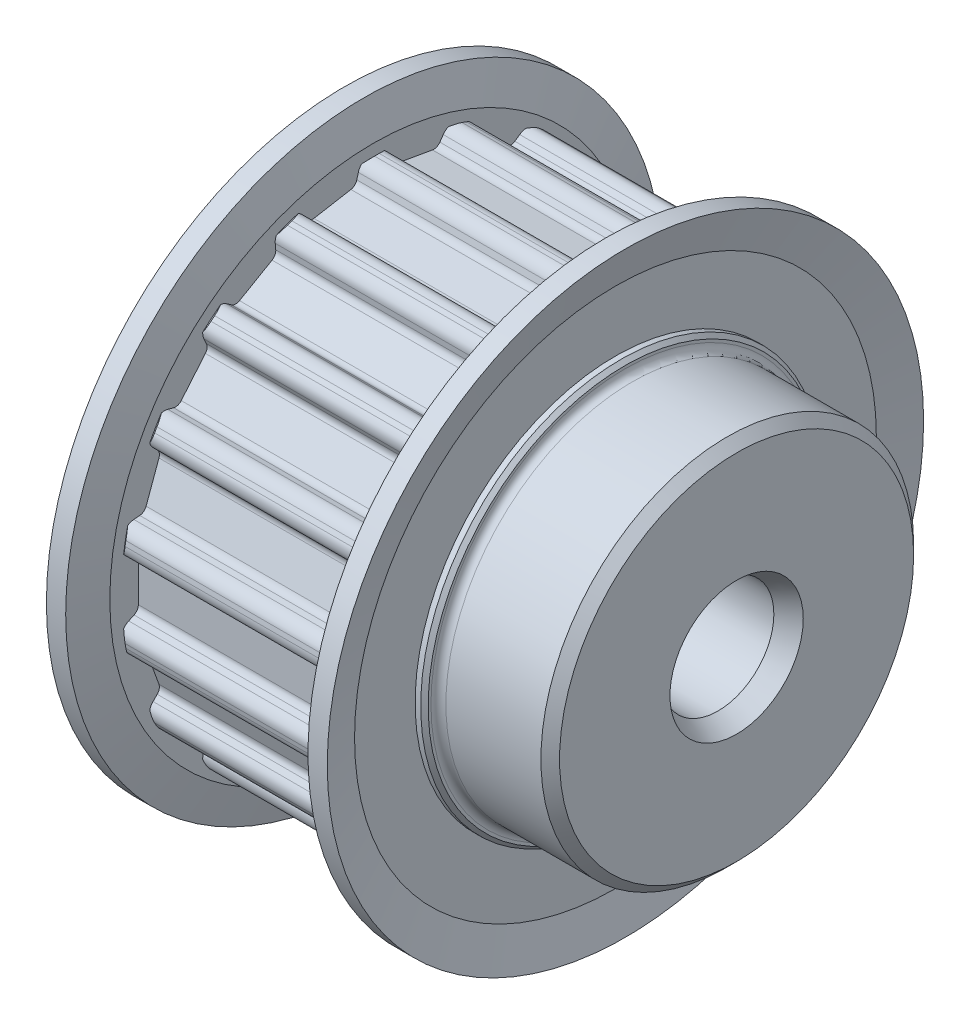
from build123d import *
from OCP.BRepFilletAPI import BRepFilletAPI_MakeChamfer

# Parameters (mm, degrees)
BOSS_EXTRUDE1_START          = 1.5
BOSS_EXTRUDE1_2_DEPTH        = 12
CUT_EXTRUDE1_START           = 0.599992
CUT_EXTRUDE1_DEPTH           = 0.2
BOSS_EXTRUDE2_START          = 0.600001
BOSS_EXTRUDE2_DEPTH          = 0.2
CUT_EXTRUDE2_START           = 0.599992
CUT_EXTRUDE2_DEPTH           = 0.2
BOSS_EXTRUDE3_START          = 0.600001
BOSS_EXTRUDE3_DEPTH          = 0.2
BOSS_EXTRUDE4_START          = 0.600001
BOSS_EXTRUDE4_DEPTH          = 0.2
DRAFT1_ANGLE                 = 66.037511025
DRAFT2_ANGLE                 = 69.44395478
DRAFT3_ANGLE                 = 48.366460663
DRAFT4_ANGLE                 = 38.418055345
DRAFT5_ANGLE                 = 53.130102354
DRAFT6_DEPTH                 = 1
F_6_0_6_DIAMETER_HOLE1_D     = 6
F_6_0_6_DIAMETER_HOLE1_DEPTH = 21.035898385
CHAMFER1_SIZE                = 0.577350568
CHAMFER1_SIZE2               = 1
CHAMFER2_SIZE                = 0.2
CHAMFER3_SIZE                = 0.5
FILLET1_R                    = 0.4
FILLET2_R                    = 0.7


with BuildPart() as part:
    # Boss-Extrude1: read off the stored shape, not the designer's step
    # Boss-Extrude1 outline → Boss-Extrude1 (revolve)
    with BuildSketch(Plane.YX):
        Polygon((13.7, 1.7), (13.7, 13.3), (13.5, 13.5), (14.131652498, 13.5), (16, 14.000622204), (16, 15.035898385), (14, 14.5), (0, 14.5), (0, 0), (10.75, 0), (10.75, 0.5), (14, 0.5), (16, -0.035898385), (16, 0.999377796), (14.131652498, 1.5), (13.5, 1.5), align=None)
        with BuildLine():
            ThreePointArc((11.55, 13.5), (11.15, 13.1), (10.75, 13.5))
            Line((10.75, 13.5), (11.55, 13.5))
        make_face(mode=Mode.SUBTRACT)
        with BuildLine():
            ThreePointArc((10.75, 1.5), (11.15, 1.9), (11.55, 1.5))
            Line((11.55, 1.5), (10.75, 1.5))
        make_face(mode=Mode.SUBTRACT)
    revolve(axis=Axis((0, 0, 0), (1, 0, 0)))

    # Boss-Extrude1 2 outline → Boss-Extrude1 2 (cut)
    with BuildSketch(Plane.YZ.offset(BOSS_EXTRUDE1_START)):
        with BuildLine():
            Line((-12.62787874, 0.944248967), (-12.189276636, 3.43168511))
            Line((-12.189276636, 3.43168511), (-13.08494624, 4.058839969))
            ThreePointArc((-13.08494624, 4.058839969), (-13.491866216, 2.378980034), (-13.684032453, 0.661253221))
            Line((-13.684032453, 0.661253221), (-12.62787874, 0.944248967))
        make_face()
        with BuildLine():
            ThreePointArc((-10.907622397, 8.289377156), (-11.864548032, 6.85), (-12.632622397, 5.301589513))
            Line((-12.632622397, 5.301589513), (-11.543372301, 5.206292683))
            Line((-11.543372301, 5.206292683), (-10.280467874, 7.393707317))
            Line((-10.280467874, 7.393707317), (-10.907622397, 8.289377156))
        make_face()
        with BuildLine():
            Line((-12.62787874, -0.944248967), (-13.684032453, -0.661253221))
            ThreePointArc((-13.684032453, -0.661253221), (-13.491866216, -2.378980034), (-13.08494624, -4.058839969))
            Line((-13.08494624, -4.058839969), (-12.189276636, -3.43168511))
            Line((-12.189276636, -3.43168511), (-12.62787874, -0.944248967))
        make_face()
        with BuildLine():
            ThreePointArc((-7.414678314, 11.52009312), (-8.806190253, 10.494808871), (-10.057531643, 9.302475867))
            Line((-10.057531643, 9.302475867), (-9.066564801, 8.840380665))
            Line((-9.066564801, 8.840380665), (-7.131682963, 10.463939302))
            Line((-7.131682963, 10.463939302), (-7.414678314, 11.52009312))
        make_face()
        with BuildLine():
            Line((-11.543372301, -5.206292683), (-12.632622397, -5.301589513))
            ThreePointArc((-12.632622397, -5.301589513), (-11.864548032, -6.85), (-10.907622397, -8.289377156))
            Line((-10.907622397, -8.289377156), (-10.280467874, -7.393707317))
            Line((-10.280467874, -7.393707317), (-11.543372301, -5.206292683))
        make_face()
        with BuildLine():
            ThreePointArc((-3.027414597, 13.361315836), (-4.685675963, 12.873788905), (-6.269354139, 12.181346341))
            Line((-6.269354139, 12.181346341), (-5.496195777, 11.408188269))
            Line((-5.496195777, 11.408188269), (-3.122711835, 12.272065775))
            Line((-3.122711835, 12.272065775), (-3.027414597, 13.361315836))
        make_face()
        with BuildLine():
            Line((-9.066564801, -8.840380665), (-10.057531643, -9.302475867))
            ThreePointArc((-10.057531643, -9.302475867), (-8.806190253, -10.494808871), (-7.414678314, -11.52009312))
            Line((-7.414678314, -11.52009312), (-7.131682963, -10.463939302))
            Line((-7.131682963, -10.463939302), (-9.066564801, -8.840380665))
        make_face()
        with BuildLine():
            ThreePointArc((1.725, 13.590966669), (0, 13.7), (-1.725, 13.590966669))
            Line((-1.725, 13.590966669), (-1.262904428, 12.6))
            Line((-1.262904428, 12.6), (1.262904428, 12.6))
            Line((1.262904428, 12.6), (1.725, 13.590966669))
        make_face()
        with BuildLine():
            Line((-5.496195777, -11.408188269), (-6.269354139, -12.181346341))
            ThreePointArc((-6.269354139, -12.181346341), (-4.685675963, -12.873788905), (-3.027414597, -13.361315836))
            Line((-3.027414597, -13.361315836), (-3.122711835, -12.272065775))
            Line((-3.122711835, -12.272065775), (-5.496195777, -11.408188269))
        make_face()
        with BuildLine():
            ThreePointArc((6.269354139, 12.181346341), (4.685675963, 12.873788905), (3.027414597, 13.361315836))
            Line((3.027414597, 13.361315836), (3.122711835, 12.272065775))
            Line((3.122711835, 12.272065775), (5.496195777, 11.408188269))
            Line((5.496195777, 11.408188269), (6.269354139, 12.181346341))
        make_face()
        with BuildLine():
            Line((-1.262904428, -12.6), (-1.725, -13.590966669))
            ThreePointArc((-1.725, -13.590966669), (0, -13.7), (1.725, -13.590966669))
            Line((1.725, -13.590966669), (1.262904428, -12.6))
            Line((1.262904428, -12.6), (-1.262904428, -12.6))
        make_face()
        with BuildLine():
            ThreePointArc((10.057531643, 9.302475867), (8.806190253, 10.494808871), (7.414678314, 11.52009312))
            Line((7.414678314, 11.52009312), (7.131682963, 10.463939302))
            Line((7.131682963, 10.463939302), (9.066564801, 8.840380665))
            Line((9.066564801, 8.840380665), (10.057531643, 9.302475867))
        make_face()
        with BuildLine():
            Line((3.122711835, -12.272065775), (3.027414597, -13.361315836))
            ThreePointArc((3.027414597, -13.361315836), (4.685675963, -12.873788905), (6.269354139, -12.181346341))
            Line((6.269354139, -12.181346341), (5.496195777, -11.408188269))
            Line((5.496195777, -11.408188269), (3.122711835, -12.272065775))
        make_face()
        with BuildLine():
            ThreePointArc((12.632622397, 5.301589513), (11.864548032, 6.85), (10.907622397, 8.289377156))
            Line((10.907622397, 8.289377156), (10.280467874, 7.393707317))
            Line((10.280467874, 7.393707317), (11.543372301, 5.206292683))
            Line((11.543372301, 5.206292683), (12.632622397, 5.301589513))
        make_face()
        with BuildLine():
            Line((7.131682963, -10.463939302), (7.414678314, -11.52009312))
            ThreePointArc((7.414678314, -11.52009312), (8.806190253, -10.494808871), (10.057531643, -9.302475867))
            Line((10.057531643, -9.302475867), (9.066564801, -8.840380665))
            Line((9.066564801, -8.840380665), (7.131682963, -10.463939302))
        make_face()
        with BuildLine():
            ThreePointArc((13.684032453, 0.661253221), (13.491866216, 2.378980034), (13.08494624, 4.058839969))
            Line((13.08494624, 4.058839969), (12.189276636, 3.43168511))
            Line((12.189276636, 3.43168511), (12.62787874, 0.944248967))
            Line((12.62787874, 0.944248967), (13.684032453, 0.661253221))
        make_face()
        with BuildLine():
            Line((10.280467874, -7.393707317), (10.907622397, -8.289377156))
            ThreePointArc((10.907622397, -8.289377156), (11.864548032, -6.85), (12.632622397, -5.301589513))
            Line((12.632622397, -5.301589513), (11.543372301, -5.206292683))
            Line((11.543372301, -5.206292683), (10.280467874, -7.393707317))
        make_face()
        with BuildLine():
            ThreePointArc((13.08494624, -4.058839969), (13.491866216, -2.378980034), (13.684032453, -0.661253221))
            Line((13.684032453, -0.661253221), (12.62787874, -0.944248967))
            Line((12.62787874, -0.944248967), (12.189276636, -3.43168511))
            Line((12.189276636, -3.43168511), (13.08494624, -4.058839969))
        make_face()
    extrude(amount=BOSS_EXTRUDE1_2_DEPTH, mode=Mode.SUBTRACT)

    # Sketch2 → Cut-Extrude1 (cut)
    with BuildSketch(Plane.ZY.offset(-0.599992262).offset(CUT_EXTRUDE1_START)):
        with BuildLine():
            Line((7.102453842, -1.979749851), (7.069100655, -1.97498511))
            Line((7.069100655, -1.97498511), (7.102453842, -1.798689696))
            ThreePointArc((7.102453842, -1.798689696), (7.033984302, -1.788179879), (6.966004345, -1.774865992))
            Line((6.966004345, -1.774865992), (6.659332936, -1.774865992))
            Line((6.659332936, -1.774865992), (6.659332936, -1.779630733))
            Line((6.659332936, -1.779630733), (6.462603977, -1.779630733))
            ThreePointArc((6.462603977, -1.779630733), (6.303573262, -1.687065269), (6.154270399, -1.579511614))
            Line((6.154270399, -1.579511614), (6.050041691, -1.496128648))
            Line((6.050041691, -1.496128648), (6.187623585, -1.496128648))
            Line((6.187623585, -1.496128648), (6.187623585, -1.491363907))
            Line((6.187623585, -1.491363907), (6.240035736, -1.419892793))
            ThreePointArc((6.240035736, -1.419892793), (6.083460263, -1.281054329), (5.944621799, -1.124478856))
            ThreePointArc((5.944621799, -1.124478856), (5.912187857, -1.146724934), (5.880297796, -1.169743895))
            Line((5.880297796, -1.169743895), (5.801679571, -1.229303157))
            add(Edge.make_bspline(
                [(5.801679571, -1.229303157), (5.780336919, -1.199256766), (5.737661723, -1.139178215), (5.674296702, -1.048506023), (5.616814382, -0.954007195), (5.564283796, -0.856422409), (5.538308043, -0.787352324), (5.525324598, -0.752829065)],
                knots=[0, 0, 0, 0, 0.200002243, 0.399909752, 0.600005409, 0.800070941, 1, 1, 1, 1], degree=3))
            Line((5.525324598, -0.752829065), (5.515795116, -0.724240619))
            Line((5.515795116, -0.724240619), (5.680178678, -0.659916617))
            ThreePointArc((5.680178678, -0.659916617), (5.619495852, -0.478169538), (5.580119119, -0.290649196))
            Line((5.580119119, -0.290649196), (5.406206075, -0.314472901))
            ThreePointArc((5.406206075, -0.314472901), (5.380013041, -0.025367619), (5.396676593, 0.264443121))
            Line((5.396676593, 0.264443121), (5.401441334, 0.295413937))
            Line((5.401441334, 0.295413937), (5.580119119, 0.273972603))
            ThreePointArc((5.580119119, 0.273972603), (5.6164888, 0.462689224), (5.675413937, 0.645622394))
            Line((5.675413937, 0.645622394), (5.511030375, 0.714711138))
            ThreePointArc((5.511030375, 0.714711138), (5.62647015, 0.963406922), (5.775473496, 1.1935676))
            Line((5.775473496, 1.1935676), (5.79691483, 1.222156045))
            ThreePointArc((5.79691483, 1.222156045), (5.833304051, 1.192873301), (5.870768314, 1.164979154))
            Line((5.870768314, 1.164979154), (5.939857058, 1.117331745))
            ThreePointArc((5.939857058, 1.117331745), (6.052027367, 1.248173052), (6.175711733, 1.368188899))
            Line((6.175711733, 1.368188899), (6.175711733, 1.484216796))
            Line((6.175711733, 1.484216796), (6.170946992, 1.484216796))
            Line((6.170946992, 1.484216796), (6.170946992, 1.488981537))
            Line((6.170946992, 1.488981537), (6.009739925, 1.488981537))
            Line((6.009739925, 1.488981537), (6.144740917, 1.569982132))
            ThreePointArc((6.144740917, 1.569982132), (6.361696399, 1.720340447), (6.597391304, 1.839189994))
            Line((6.597391304, 1.839189994), (6.62597975, 1.851101846))
            Line((6.62597975, 1.851101846), (6.654568195, 1.774865992))
            Line((6.654568195, 1.774865992), (6.697450864, 1.689100655))
            ThreePointArc((6.697450864, 1.689100655), (6.892507023, 1.7579514), (7.09530673, 1.798689696))
            ThreePointArc((7.09530673, 1.798689696), (7.091590782, 1.841688897), (7.085777248, 1.884455033))
            Line((7.085777248, 1.884455033), (7.069100655, 1.97498511))
            ThreePointArc((7.069100655, 1.97498511), (7.224602663, 1.994013629), (7.381191185, 1.998808815))
            add(Edge.make_bspline(
                [(7.381191185, 1.998808815), (7.45203674, 1.996994621), (7.593198497, 1.993379789), (7.803193753, 1.962181387), (8.008880995, 1.909925003), (8.207528977, 1.834674717), (8.395746858, 1.737295748), (8.571868231, 1.619595106), (8.734797845, 1.483520074), (8.884192866, 1.332295422), (9.018302331, 1.167257658), (9.133886475, 0.988708549), (9.228369717, 0.798341396), (9.300357373, 0.598770411), (9.349108675, 0.39234191), (9.376352752, 0.181454409), (9.383074903, -0.031437727), (9.370550275, -0.24421045), (9.337166254, -0.454088906), (9.28149928, -0.658415725), (9.203139502, -0.85499281), (9.102296581, -1.041880183), (8.980922003, -1.216827762), (8.841873002, -1.37824624), (8.688224759, -1.525375246), (8.521145912, -1.656390142), (8.341045669, -1.768494296), (8.149013054, -1.859427694), (7.947717296, -1.928135503), (7.739965459, -1.973935165), (7.528595626, -1.997119286), (7.315027869, -2.002644728), (7.173342355, -1.987384762), (7.102453842, -1.979749851)],
                knots=[0, 0, 0, 0, 0.032308071, 0.064374738, 0.096613275, 0.128966068, 0.161062086, 0.193088519, 0.225413543, 0.257744152, 0.28992787, 0.322264636, 0.35457742, 0.386674981, 0.418841227, 0.451152528, 0.483525581, 0.515877705, 0.548253272, 0.580304222, 0.612295338, 0.644586562, 0.676975285, 0.709246578, 0.74162594, 0.773880904, 0.805940243, 0.838206323, 0.870603399, 0.902776772, 0.935049547, 0.967503798, 1, 1, 1, 1], degree=3))
        make_face()
    extrude(amount=-CUT_EXTRUDE1_DEPTH, mode=Mode.SUBTRACT)

    # Sketch3 → Boss-Extrude2 (add)
    with BuildSketch(Plane(origin=(-0.400000872, 0, 0), x_dir=(0, 0, -1), z_dir=(1, 0, 0)).offset(BOSS_EXTRUDE2_START)):
        with BuildLine():
            Line((-7.140571769, 1.927337701), (-7.159630733, 1.751042287))
            ThreePointArc((-7.159630733, 1.751042287), (-6.922326928, 1.70207879), (-6.692686123, 1.624776653))
            add(Edge.make_bspline(
                [(-6.692686123, 1.624776653), (-6.691296746, 1.624181206), (-6.688517605, 1.622990145), (-6.684348699, 1.621203471), (-6.680179405, 1.619416631), (-6.676010111, 1.617629791), (-6.671840818, 1.615842951), (-6.667671524, 1.61405611), (-6.66350223, 1.61226927), (-6.660722701, 1.611078043), (-6.659332936, 1.61048243)],
                knots=[0, 0, 0, 0, 0.12496947, 0.249973831, 0.374978193, 0.499982554, 0.624986916, 0.749991277, 0.874995639, 1, 1, 1, 1], degree=3))
            Line((-6.659332936, 1.61048243), (-6.592626563, 1.770101251))
            ThreePointArc((-6.592626563, 1.770101251), (-6.392344486, 1.668083212), (-6.206682549, 1.541393687))
            Line((-6.206682549, 1.541393687), (-6.311506849, 1.4032162))
            ThreePointArc((-6.311506849, 1.4032162), (-6.13435142, 1.233706361), (-5.966063133, 1.055390113))
            add(Edge.make_bspline(
                [(-5.966063133, 1.055390113), (-5.965368772, 1.054596558), (-5.963979482, 1.053008798), (-5.961895263, 1.050626833), (-5.959810476, 1.048244219), (-5.957725688, 1.045861605), (-5.955640901, 1.043478991), (-5.953556114, 1.041096377), (-5.951471327, 1.038713763), (-5.950081469, 1.037125354), (-5.94938654, 1.036331149)],
                knots=[0, 0, 0, 0, 0.124910577, 0.249923352, 0.374936127, 0.499948901, 0.624961676, 0.749974451, 0.874987225, 1, 1, 1, 1], degree=3))
            Line((-5.94938654, 1.036331149), (-5.811209053, 1.136390709))
            ThreePointArc((-5.811209053, 1.136390709), (-5.689058059, 0.947484388), (-5.5896486, 0.745681954))
            Line((-5.5896486, 0.745681954), (-5.751649792, 0.67421084))
            add(Edge.make_bspline(
                [(-5.751649792, 0.67421084), (-5.742200064, 0.654565829), (-5.72334319, 0.615364326), (-5.70217177, 0.553575044), (-5.684745688, 0.490809001), (-5.669167233, 0.427503392), (-5.655013826, 0.363862237), (-5.642014847, 0.299969705), (-5.634104327, 0.257226959), (-5.630148898, 0.235854675)],
                knots=[0, 0, 0, 0, 0.143193844, 0.285742462, 0.428554327, 0.571406405, 0.714249876, 0.85711885, 1, 1, 1, 1], degree=3))
            add(Edge.make_bspline(
                [(-5.630148898, 0.235854675), (-5.629950276, 0.234762251), (-5.629553135, 0.232577979), (-5.628957477, 0.229301859), (-5.628361924, 0.226026316), (-5.62776637, 0.222750773), (-5.627170817, 0.21947523), (-5.626575264, 0.216199687), (-5.625979711, 0.212924144), (-5.625582675, 0.210740448), (-5.625384157, 0.2096486)],
                knots=[0, 0, 0, 0, 0.12505775, 0.2500495, 0.37504125, 0.500033, 0.62502475, 0.7500165, 0.87500825, 1, 1, 1, 1], degree=3))
            Line((-5.625384157, 0.2096486), (-5.456235855, 0.228707564))
            ThreePointArc((-5.456235855, 0.228707564), (-5.441909228, -0.008338297), (-5.456235855, -0.245384157))
            Line((-5.456235855, -0.245384157), (-5.630148898, -0.219178082))
            ThreePointArc((-5.630148898, -0.219178082), (-5.678073774, -0.445842803), (-5.746885051, -0.667063728))
            add(Edge.make_bspline(
                [(-5.746885051, -0.667063728), (-5.747282226, -0.668255256), (-5.748076448, -0.670637919), (-5.749267714, -0.674211719), (-5.750458851, -0.677785128), (-5.751649987, -0.681358537), (-5.752841123, -0.684931947), (-5.75403226, -0.688505356), (-5.755223396, -0.692078765), (-5.756017487, -0.694461038), (-5.756414532, -0.695652174)],
                knots=[0, 0, 0, 0, 0.125035884, 0.250030758, 0.375025632, 0.500020505, 0.625015379, 0.750010253, 0.875005126, 1, 1, 1, 1], degree=3))
            Line((-5.756414532, -0.695652174), (-5.596795712, -0.757593806))
            ThreePointArc((-5.596795712, -0.757593806), (-5.695249061, -0.956889786), (-5.815973794, -1.14353782))
            Line((-5.815973794, -1.14353782), (-5.961298392, -1.043478261))
            Line((-5.961298392, -1.043478261), (-5.975592615, -1.069684336))
            ThreePointArc((-5.975592615, -1.069684336), (-6.12696199, -1.242179523), (-6.297212627, -1.396069089))
            Line((-6.297212627, -1.396069089), (-6.321036331, -1.410363311))
            Line((-6.321036331, -1.410363311), (-6.216212031, -1.548540798))
            ThreePointArc((-6.216212031, -1.548540798), (-6.402301341, -1.673440205), (-6.602156045, -1.774865992))
            Line((-6.602156045, -1.774865992), (-6.664097677, -1.615247171))
            ThreePointArc((-6.664097677, -1.615247171), (-6.899003385, -1.694833633), (-7.140571769, -1.751042287))
            Line((-7.140571769, -1.751042287), (-7.171542585, -1.751042287))
            Line((-7.171542585, -1.751042287), (-7.171542585, -1.93045584))
            add(Edge.make_bspline(
                [(-7.171542585, -1.93045584), (-7.250042229, -1.935683482), (-7.406726233, -1.94611777), (-7.641648205, -1.930113263), (-7.872566568, -1.888909159), (-8.096484307, -1.818024335), (-8.309298685, -1.71902478), (-8.507413052, -1.59330235), (-8.688824367, -1.44463635), (-8.853665614, -1.276757873), (-8.998888751, -1.091072148), (-9.120288605, -0.889847569), (-9.213830073, -0.675396732), (-9.279128766, -0.450718371), (-9.316080671, -0.219135987), (-9.326929114, 0.015798937), (-9.312887368, 0.250323001), (-9.272515888, 0.481263377), (-9.203935925, 0.7052702), (-9.106319677, 0.91849823), (-8.982262587, 1.117746035), (-8.834590522, 1.300375038), (-8.668152273, 1.465643919), (-8.484826284, 1.611418149), (-8.285010899, 1.733354137), (-8.070994602, 1.828675996), (-7.846311148, 1.895031809), (-7.615092445, 1.934792813), (-7.459325126, 1.939347341), (-7.381191185, 1.941631924)],
                knots=[0, 0, 0, 0, 0.037306041, 0.074462245, 0.111427352, 0.148403624, 0.185607573, 0.222518384, 0.259467575, 0.296693194, 0.333968825, 0.371099911, 0.407931997, 0.4446954, 0.481852835, 0.518972765, 0.556109067, 0.593145534, 0.629984766, 0.666988335, 0.704132457, 0.741088396, 0.778211151, 0.815249187, 0.851998464, 0.88901831, 0.926111128, 0.962936842, 1, 1, 1, 1], degree=3))
            ThreePointArc((-7.381191185, 1.941631924), (-7.260694574, 1.937631016), (-7.140571769, 1.927337701))
        make_face()
    extrude(amount=-BOSS_EXTRUDE2_DEPTH)

    # Sketch4 → Cut-Extrude2 (cut)
    with BuildSketch(Plane.ZY.offset(-0.599992262).offset(CUT_EXTRUDE2_START)):
        with BuildLine():
            Line((7.381191185, -1.824895771), (7.350220369, -1.824895771))
            Line((7.350220369, -1.824895771), (7.350220369, -1.272185825))
            add(Edge.make_bspline(
                [(7.350220369, -1.272185825), (7.310700091, -1.258274722), (7.231836083, -1.230514662), (7.121730852, -1.169212079), (7.020828879, -1.093912397), (6.931049401, -1.00518577), (6.853246018, -0.906047755), (6.790759144, -0.796479623), (6.747000456, -0.678349906), (6.723273481, -0.554440566), (6.719425729, -0.428716314), (6.728852086, -0.303492176), (6.75287842, -0.180059215), (6.794480517, -0.060949375), (6.855171124, 0.049947998), (6.931514287, 0.151502541), (6.994603224, 0.207695557), (7.026217987, 0.235854675)],
                knots=[0, 0, 0, 0, 0.066581319, 0.132865203, 0.199617166, 0.266412632, 0.333153695, 0.399599409, 0.466319627, 0.532724342, 0.599444346, 0.66592196, 0.732240512, 0.79902568, 0.865821558, 0.932761276, 1, 1, 1, 1], degree=3))
            add(Edge.make_bspline(
                [(7.026217987, 0.235854675), (7.038619729, 0.200967957), (7.063347977, 0.131406163), (7.114407181, 0.033142177), (7.178365708, -0.0567711), (7.256359852, -0.136028013), (7.318869324, -0.17553834), (7.350220369, -0.195354378)],
                knots=[0, 0, 0, 0, 0.201015049, 0.400810624, 0.599310374, 0.799037837, 1, 1, 1, 1], degree=3))
            Line((7.350220369, -0.195354378), (7.350220369, 0.285884455))
            Line((7.350220369, 0.285884455), (6.030387135, 0.285884455))
            add(Edge.make_bspline(
                [(6.030387135, 0.285884455), (6.04746587, 0.352827835), (6.081566188, 0.48649058), (6.167713972, 0.675728251), (6.279703538, 0.850128566), (6.417431516, 1.005539467), (6.574534864, 1.140348423), (6.749842049, 1.251280021), (6.940693782, 1.332005929), (7.142807745, 1.382324481), (7.28098397, 1.38989389), (7.350220369, 1.393686718)],
                knots=[0, 0, 0, 0, 0.111208475, 0.222044808, 0.333472008, 0.444245955, 0.555598104, 0.666232026, 0.777291836, 0.888406914, 1, 1, 1, 1], degree=3))
            Line((7.350220369, 1.393686718), (7.350220369, 1.824895771))
            add(Edge.make_bspline(
                [(7.381190873, 1.824895771), (7.379900435, 1.824895771), (7.37731956, 1.824895771), (7.373448247, 1.824895771), (7.369576934, 1.824895771), (7.365705621, 1.824895771), (7.361834308, 1.824895771), (7.357962995, 1.824895771), (7.354091682, 1.824895771), (7.351510807, 1.824895771), (7.350220369, 1.824895771)],
                knots=[0, 0, 0, 0, 0.125, 0.25, 0.375, 0.5, 0.625, 0.75, 0.875, 1, 1, 1, 1], degree=3))
            add(Edge.make_bspline(
                [(7.381190873, 1.824895771), (7.45240589, 1.822887825), (7.594365027, 1.818885208), (7.804830898, 1.784377351), (8.009828187, 1.726836857), (8.205686613, 1.643661231), (8.389606169, 1.536631961), (8.559235126, 1.407962248), (8.71391988, 1.261226235), (8.852638044, 1.09892977), (8.971251491, 0.921321305), (9.067128347, 0.730579495), (9.137491595, 0.529157516), (9.182740742, 0.32083677), (9.204682178, 0.108492302), (9.204582921, -0.105245646), (9.183240311, -0.317620673), (9.137909607, -0.52554017), (9.067728949, -0.726227076), (8.972493077, -0.916774263), (8.854169689, -1.094522915), (8.715593862, -1.257087995), (8.560950529, -1.404136316), (8.391407467, -1.533418474), (8.207468842, -1.641241144), (8.011443412, -1.725317676), (7.806002273, -1.783587889), (7.594957347, -1.818720633), (7.452570555, -1.82283381), (7.381191185, -1.824895771)],
                knots=[0, 0, 0, 0, 0.037162807, 0.074079881, 0.111016391, 0.148094492, 0.184859296, 0.221837507, 0.2590005, 0.295976674, 0.333079957, 0.370234485, 0.407135284, 0.444172871, 0.481285841, 0.518379094, 0.555584527, 0.592516302, 0.629221744, 0.666298282, 0.703439043, 0.740428093, 0.777598603, 0.814655615, 0.851496301, 0.888639445, 0.925697557, 0.962751731, 1, 1, 1, 1], degree=3))
        make_face()
    extrude(amount=-CUT_EXTRUDE2_DEPTH, mode=Mode.SUBTRACT)

    # Sketch5 → Boss-Extrude3 (add)
    with BuildSketch(Plane(origin=(-0.400000872, 0, 0), x_dir=(0, 0, -1), z_dir=(1, 0, 0)).offset(BOSS_EXTRUDE3_START)):
        with BuildLine():
            Line((-7.40739726, 1.76533651), (-7.40739726, 1.393686718))
            add(Edge.make_bspline(
                [(-7.40739726, 1.393686718), (-7.476521095, 1.39014754), (-7.614298432, 1.383093264), (-7.816127547, 1.335479127), (-8.007823202, 1.257768233), (-8.184133894, 1.149130436), (-8.341943404, 1.01435891), (-8.480152217, 0.859623535), (-8.595463876, 0.687279152), (-8.683287145, 0.499948376), (-8.739677229, 0.301222982), (-8.767752817, 0.096836126), (-8.769703692, -0.109495119), (-8.747653968, -0.314563531), (-8.697282196, -0.515229963), (-8.61483415, -0.705034314), (-8.501439254, -0.878479397), (-8.360262497, -1.030310623), (-8.199783547, -1.161656766), (-8.018670568, -1.26404428), (-7.819290124, -1.322864011), (-7.610614972, -1.333273692), (-7.475299292, -1.305288092), (-7.40739726, -1.291244789)],
                knots=[0, 0, 0, 0, 0.047854729, 0.095383845, 0.142801274, 0.190549288, 0.238125312, 0.286039388, 0.333791933, 0.381228708, 0.428704989, 0.476284599, 0.523682958, 0.571262089, 0.618753225, 0.66639454, 0.713896459, 0.761534428, 0.80942109, 0.857040866, 0.904595619, 0.952125641, 1, 1, 1, 1], degree=3))
            Line((-7.40739726, -1.291244789), (-7.40739726, -1.76533651))
            add(Edge.make_bspline(
                [(-7.40739726, -1.76533651), (-7.481124983, -1.761632553), (-7.628118881, -1.754247827), (-7.845038956, -1.711429176), (-8.055062378, -1.643263757), (-8.253909298, -1.546962942), (-8.43840306, -1.425607167), (-8.606116449, -1.281903546), (-8.756660195, -1.120387703), (-8.887200906, -0.942386711), (-8.993911553, -0.7492441), (-9.073341414, -0.543235846), (-9.124637674, -0.328580608), (-9.148258138, -0.109032281), (-9.146946139, 0.112000849), (-9.121570042, 0.331749974), (-9.070182198, 0.546342124), (-8.990821323, 0.752348903), (-8.884528471, 0.945774607), (-8.753810228, 1.123816893), (-8.603067588, 1.284775601), (-8.435605241, 1.427751056), (-8.251568799, 1.548601268), (-8.053343376, 1.644152071), (-7.843942937, 1.711969589), (-7.627470325, 1.754399396), (-7.48091681, 1.761682761), (-7.40739726, 1.76533651)],
                knots=[0, 0, 0, 0, 0.040200279, 0.080148898, 0.120114596, 0.160278551, 0.20020609, 0.240166862, 0.280394098, 0.320319041, 0.360199643, 0.400328085, 0.44030684, 0.480166459, 0.520414411, 0.56056665, 0.600501089, 0.640379461, 0.680549981, 0.720455919, 0.760471637, 0.80051487, 0.840214785, 0.880164444, 0.920091884, 0.959913559, 1, 1, 1, 1], degree=3))
        make_face()
    extrude(amount=-BOSS_EXTRUDE3_DEPTH)

    # Sketch6 → Boss-Extrude4 (add)
    with BuildSketch(Plane(origin=(-0.400000872, 0, 0), x_dir=(0, 0, -1), z_dir=(1, 0, 0)).offset(BOSS_EXTRUDE4_START)):
        with BuildLine():
            Line((-7.40739726, 0.285884455), (-7.40739726, -0.226325194))
            add(Edge.make_bspline(
                [(-7.40739726, -0.226325194), (-7.433944176, -0.236911021), (-7.486925703, -0.258037894), (-7.571872101, -0.27070744), (-7.657222602, -0.268349102), (-7.740560582, -0.248662931), (-7.817410386, -0.210561807), (-7.883223126, -0.155128011), (-7.928521004, -0.081282808), (-7.947512938, 0.002901233), (-7.941846799, 0.088873208), (-7.908775664, 0.16906305), (-7.850892406, 0.232414646), (-7.776335731, 0.277933944), (-7.719415181, 0.283230838), (-7.690899345, 0.285884455)],
                knots=[0, 0, 0, 0, 0.077402522, 0.154477602, 0.231267458, 0.308170181, 0.38508564, 0.462292546, 0.538805094, 0.615946026, 0.693059762, 0.769437315, 0.846554039, 0.923127237, 1, 1, 1, 1], degree=3))
            add(Edge.make_bspline(
                [(-7.690899345, 0.285884455), (-7.659399019, 0.285884455), (-7.596398509, 0.285884455), (-7.501897814, 0.285884455), (-7.438897445, 0.285884455), (-7.40739726, 0.285884455)],
                knots=[0, 0, 0, 0, 0.333334328, 0.666667164, 1, 1, 1, 1], degree=3))
        make_face()
    extrude(amount=-BOSS_EXTRUDE4_DEPTH)

    # Draft1
    draft1_faces = [part.faces().sort_by_distance(p)[0] for p in [
        (0.100000262, -1.774865992, 6.81266864),
    ]]
    draft(draft1_faces, Plane(origin=(0.2, 0, 6.659332936), x_dir=(0, -1, 0), z_dir=(0, 0, -1)), DRAFT1_ANGLE)

    # Draft2
    draft2_faces = [part.faces().sort_by_distance(p)[0] for p in [
        (0.100000262, -1.779630733, 6.560968457),
    ]]
    draft(draft2_faces, Plane(origin=(0.2, 0, 6.659332936), x_dir=(0, -1, 0), z_dir=(0, 0, -1)), DRAFT2_ANGLE)

    # Draft3
    draft3_faces = [part.faces().sort_by_distance(p)[0] for p in [
        (0.100000262, -1.496128648, 6.118832638),
    ]]
    draft(draft3_faces, Plane(origin=(0.2, 0, 6.187623585), x_dir=(1, 0, 0), z_dir=(0, 0, 1)), DRAFT3_ANGLE)

    # Draft4
    draft4_faces = [part.faces().sort_by_distance(p)[0] for p in [
        (0.100000262, 1.426202848, 6.175711733),
    ]]
    draft(draft4_faces, Plane(origin=(0.2, 1.484216796, 0), x_dir=(1, 0, 0), z_dir=(0, 1, 0)), DRAFT4_ANGLE)

    # Draft5
    draft5_faces = [part.faces().sort_by_distance(p)[0] for p in [
        (0.100000262, 1.488981537, 6.090343458),
    ]]
    draft(draft5_faces, Plane(origin=(0.2, 0, 6.170946992), x_dir=(1, 0, 0), z_dir=(0, 0, 1)), DRAFT5_ANGLE)

    # Draft6: read off the stored shape, not the designer's step
    # Draft6 outline → Draft6 (add)
    with BuildSketch(Plane.YZ):
        with BuildLine():
            add(Edge.make_bspline(
                [(-1.93045584, 7.171542585), (-1.929764276, 7.161157877), (-1.929072712, 7.150773169), (-1.928381148, 7.140388461)],
                knots=[1, 1, 1, 1, 1.004935211, 1.004935211, 1.004935211, 1.004935211], degree=3))
            Line((-1.928381148, 7.140388461), (-1.751042287, 7.171542585))
            Line((-1.751042287, 7.171542585), (-1.93045584, 7.171542585))
        make_face()
    extrude(amount=DRAFT6_DEPTH)

    # Sketch7 → Revolve1 (revolve)
    with BuildSketch(Plane(origin=(0, 0, 0), x_dir=(-1, 0, 0), z_dir=(0, 0, -1)), mode=Mode.PRIVATE) as revolve1_sk:
        Polygon((-21, 10), (-21, 0), (-14.5, 0), (-14.5, 10.75), (-15, 10.75), (-15, 10), align=None)
    revolve(revolve1_sk.sketch.rotate(Axis((21, 0, 0), (-1, 0, 0)), 270), axis=Axis((21, 0, 0), (-1, 0, 0)))

    # Ø6.0 (6) Diameter Hole1
    with Locations(Plane(origin=(21, 0, 0), x_dir=(0, 0, -1), z_dir=(1, 0, 0))):
        with Locations((0, 0)):
            Hole(F_6_0_6_DIAMETER_HOLE1_D / 2, depth=F_6_0_6_DIAMETER_HOLE1_DEPTH)

    # Chamfer1: one chamfer whose edges measure the first distance from different faces: ONE call of the kernel's chamfer builder (chamfer() names one face for all edges)
    chamfer1_edges_1 = [part.edges().sort_by_distance(p)[0] for p in [
        (0, 0, -3),
    ]]
    chamfer1_side_1 = [part.faces().sort_by_distance(p)[0] for p in [
        (0, -10.445944081, 0),
    ]]
    chamfer1_edges_2 = [part.edges().sort_by_distance(p)[0] for p in [
        (21, 0, -3),
    ]]
    chamfer1_side_2 = [part.faces().sort_by_distance(p)[0] for p in [
        (21, 0, -9.717157288),
    ]]
    chamfer1 = BRepFilletAPI_MakeChamfer(part.part.solid().wrapped)
    for e in chamfer1_edges_1:
        chamfer1.Add(CHAMFER1_SIZE, CHAMFER1_SIZE2, e.wrapped, chamfer1_side_1[0].wrapped)  # the first distance lies on this face
    for e in chamfer1_edges_2:
        chamfer1.Add(CHAMFER1_SIZE, CHAMFER1_SIZE2, e.wrapped, chamfer1_side_2[0].wrapped)  # the first distance lies on this face
    add(Compound.cast(chamfer1.Shape()), mode=Mode.REPLACE)

    # Chamfer2
    chamfer2_edges = [part.edges().sort_by_distance(p)[0] for p in [
        (0, -10.75, 0),
        (15, 0, -10.75),
    ]]
    chamfer(chamfer2_edges, length=CHAMFER2_SIZE)

    # Chamfer3
    chamfer3_edges = [part.edges().sort_by_distance(p)[0] for p in [
        (21, 0, -10),
    ]]
    chamfer(chamfer3_edges, length=CHAMFER3_SIZE)

    # Fillet1
    fillet1_edges = [part.edges().sort_by_distance(p)[0] for p in [
        (15, 0, -10),
        (7.5, -5.496195777, 11.408188269),
        (7.5, 10.280467874, 7.393707317),
        (7.5, 12.62787874, -0.944248967),
        (7.5, -12.189276636, 3.43168511),
        (7.5, 3.122711835, 12.272065775),
        (7.5, -12.62787874, 0.944248967),
        (7.5, -11.543372301, 5.206292683),
        (7.5, -12.62787874, -0.944248967),
        (7.5, 12.189276636, 3.43168511),
        (7.5, -12.189276636, -3.43168511),
        (7.5, 7.131682963, 10.463939302),
        (7.5, -11.543372301, -5.206292683),
        (7.5, -1.262904428, 12.6),
        (7.5, -10.280467874, -7.393707317),
        (7.5, -9.066564801, 8.840380665),
        (7.5, -9.066564801, -8.840380665),
        (7.5, 12.189276636, -3.43168511),
        (7.5, -7.131682963, -10.463939302),
        (7.5, 12.62787874, 0.944248967),
        (7.5, -5.496195777, -11.408188269),
        (7.5, 11.543372301, 5.206292683),
        (7.5, -3.122711835, -12.272065775),
        (7.5, 9.066564801, 8.840380665),
        (7.5, -1.262904428, -12.6),
        (7.5, 5.496195777, 11.408188269),
        (7.5, 1.262904428, -12.6),
        (7.5, 1.262904428, 12.6),
        (7.5, 3.122711835, -12.272065775),
        (7.5, -3.122711835, 12.272065775),
        (7.5, 5.496195777, -11.408188269),
        (7.5, -7.131682963, 10.463939302),
        (7.5, 7.131682963, -10.463939302),
        (7.5, -10.280467874, 7.393707317),
        (7.5, 9.066564801, -8.840380665),
        (7.5, 11.543372301, -5.206292683),
        (7.5, 10.280467874, -7.393707317),
    ]]
    fillet(fillet1_edges, radius=FILLET1_R)

    # Fillet2
    fillet2_edges = [part.edges().sort_by_distance(p)[0] for p in [
        (7.5, -6.269354139, 12.181346341),
        (7.5, 10.907622397, 8.289377156),
        (7.5, 13.684032453, -0.661253221),
        (7.5, -13.684032453, 0.661253221),
        (7.5, 3.027414597, 13.361315836),
        (7.5, -13.684032453, -0.661253221),
        (7.5, 12.632622397, -5.301589513),
        (7.5, -13.08494624, -4.058839969),
        (7.5, 13.08494624, 4.058839969),
        (7.5, -12.632622397, -5.301589513),
        (7.5, 7.414678314, 11.52009312),
        (7.5, -10.907622397, -8.289377156),
        (7.5, -1.725, 13.590966669),
        (7.5, -10.057531643, -9.302475867),
        (7.5, -10.057531643, 9.302475867),
        (7.5, -7.414678314, -11.52009312),
        (7.5, 13.08494624, -4.058839969),
        (7.5, -6.269354139, -12.181346341),
        (7.5, 13.684032453, 0.661253221),
        (7.5, -3.027414597, -13.361315836),
        (7.5, 12.632622397, 5.301589513),
        (7.5, -1.725, -13.590966669),
        (7.5, 10.057531643, 9.302475867),
        (7.5, 1.725, -13.590966669),
        (7.5, 6.269354139, 12.181346341),
        (7.5, 3.027414597, -13.361315836),
        (7.5, 1.725, 13.590966669),
        (7.5, 6.269354139, -12.181346341),
        (7.5, -3.027414597, 13.361315836),
        (7.5, 7.414678314, -11.52009312),
        (7.5, -7.414678314, 11.52009312),
        (7.5, 10.057531643, -9.302475867),
        (7.5, -13.08494624, 4.058839969),
        (7.5, -12.632622397, 5.301589513),
        (7.5, 10.907622397, -8.289377156),
        (7.5, -10.907622397, 8.289377156),
    ]]
    fillet(fillet2_edges, radius=FILLET2_R)


solid = part.part
